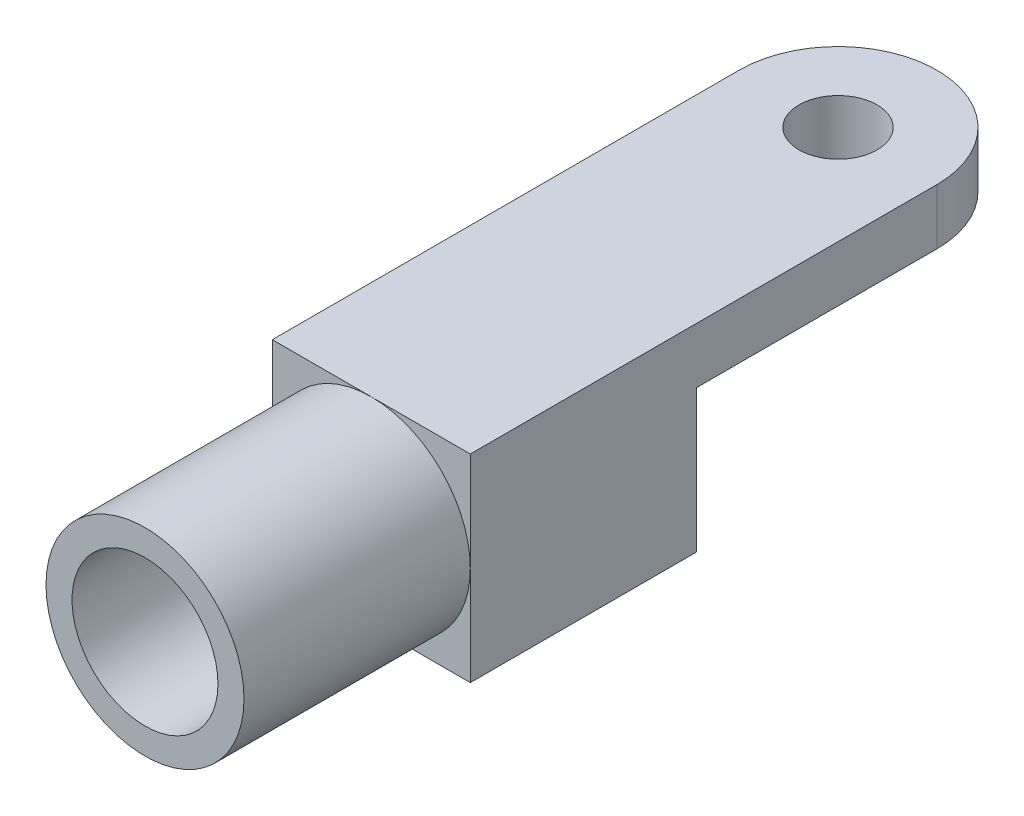
from build123d import *

# Parameters (mm, degrees)
SKETCH1_R           = 4.445
SKETCH1_R_2         = 3.275000003
BOSS_EXTRUDE1_DEPTH = 10.16
SKETCH2_W           = 8.89
SKETCH2_H           = 8.89
BOSS_EXTRUDE2_DEPTH = 25.4
SKETCH3_R           = 1.7526
CUT_EXTRUDE1_DEPTH  = 28.275449126
SKETCH4_W           = 15.24
SKETCH4_H           = 6.39064
CUT_EXTRUDE2_DEPTH  = 28.275449126


with BuildPart() as part:
    # Sketch1 → Boss-Extrude1 (new body)
    with BuildSketch(Plane.XY):
        Circle(SKETCH1_R)
        Circle(SKETCH1_R_2, mode=Mode.SUBTRACT)
    extrude(amount=BOSS_EXTRUDE1_DEPTH)

    # Sketch2 → Boss-Extrude2 (add)
    with BuildSketch(Plane(origin=(0, 0, 0), x_dir=(-1, 0, 0), z_dir=(0, 0, -1))):
        Rectangle(SKETCH2_W, SKETCH2_H)
    extrude(amount=BOSS_EXTRUDE2_DEPTH)

    # Sketch3 → Cut-Extrude1 (cut, through all)
    with BuildSketch(Plane.XZ.offset(4.445)):
        with BuildLine():
            ThreePointArc((0, -25.4), (-3.143089642, -24.098089642), (-4.445, -20.955))
            Line((-4.445, -20.955), (-4.445, -25.4))
            Line((-4.445, -25.4), (0, -25.4))
        make_face()
        with Locations((0, -20.955)):
            Circle(SKETCH3_R)
        with BuildLine():
            Line((4.445, -25.4), (4.445, -20.955))
            ThreePointArc((4.445, -20.955), (3.143089642, -24.098089642), (0, -25.4))
            Line((0, -25.4), (4.445, -25.4))
        make_face()
    extrude(amount=-CUT_EXTRUDE1_DEPTH, mode=Mode.SUBTRACT)

    # Sketch4 → Cut-Extrude2 (cut, through all)
    with BuildSketch(Plane.ZY.offset(4.445)):
        with Locations((-17.78, -1.24968)):
            Rectangle(SKETCH4_W, SKETCH4_H)
    extrude(amount=-CUT_EXTRUDE2_DEPTH, mode=Mode.SUBTRACT)


solid = part.part
